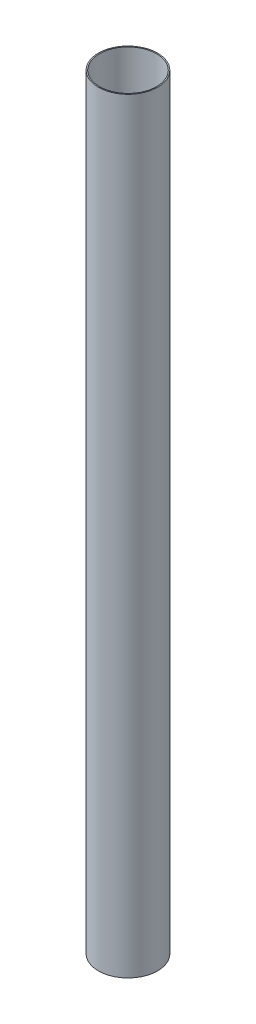
from build123d import *

# Parameters (mm, degrees)
SKETCH1_R           = 41
SKETCH1_R_2         = 39.5
BOSS_EXTRUDE1_DEPTH = 1060


with BuildPart() as part:
    # Sketch1 → Boss-Extrude1 (new body)
    with BuildSketch(Plane(origin=(0, 0, 0), x_dir=(1, 0, 0), z_dir=(0, 1, 0))):
        Circle(SKETCH1_R)
        Circle(SKETCH1_R_2, mode=Mode.SUBTRACT)
    extrude(amount=BOSS_EXTRUDE1_DEPTH)


solid = part.part
